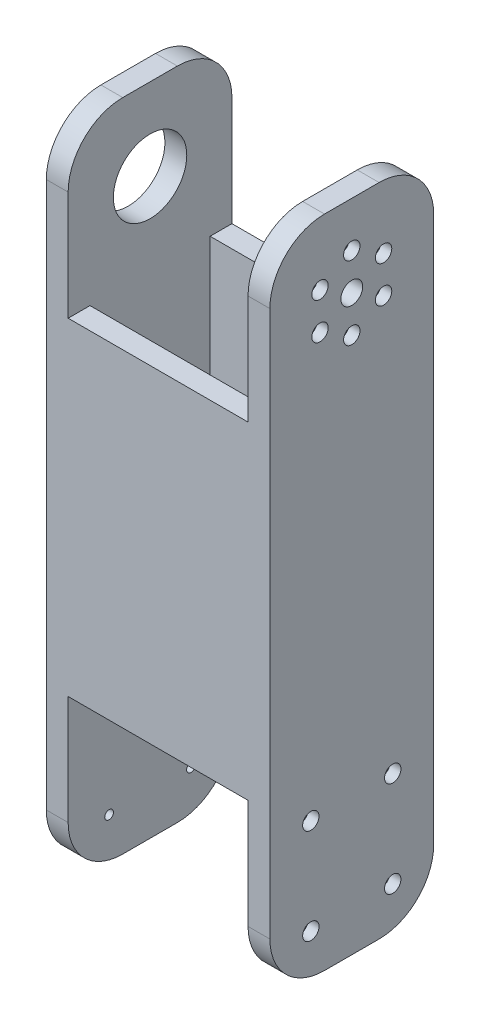
from build123d import *

# Parameters (mm, degrees)
SKETCH_1_W          = 60
SKETCH_1_H          = 240
EXTRUDE_1_DEPTH     = 8
SKETCH_2_R          = 13.45
CUT_EXTRUDE_1_DEPTH = 124.951603459
SKETCH_3_W          = 8
SKETCH_3_H          = 120
EXTRUDE_2_DEPTH     = 65.9
SKETCH_4_W          = 60
SKETCH_4_H          = 240
EXTRUDE_3_DEPTH     = 8
FILLET_1_R          = 20
CUT_EXTRUDE_2_REACH = 150.35
SKETCH_10_R         = 4
SKETCH_10_R_2       = 1.6
SKETCH_11_R         = 1.6
CUT_EXTRUDE_3_DEPTH = 149.349620829
SKETCH_12_R         = 3
CUT_EXTRUDE_4_DEPTH = 4
SKETCH_13_R         = 3
CUT_EXTRUDE_5_DEPTH = 4
CUT_EXTRUDE_START   = -4
SKETCH_14_R         = 3
CUT_EXTRUDE_6_DEPTH = 4


with BuildPart() as part:
    # 草图1 → 凸台-拉伸1 (new body)
    with BuildSketch(Plane(origin=(0, 0, 0), x_dir=(0, 0, -1), z_dir=(1, 0, 0))):
        Rectangle(SKETCH_1_W, SKETCH_1_H)
    extrude(amount=EXTRUDE_1_DEPTH)

    # 草图2 → 切除-拉伸1 (cut, through all)
    with BuildSketch(Plane(origin=(8, 0, 0), x_dir=(0, 0, -1), z_dir=(1, 0, 0))):
        with Locations((0, 90)):
            Circle(SKETCH_2_R)
    extrude(amount=-CUT_EXTRUDE_1_DEPTH, mode=Mode.SUBTRACT)

    # 草图3 → 凸台-拉伸2 (add)
    with BuildSketch(Plane(origin=(8, 0, 0), x_dir=(0, 0, -1), z_dir=(1, 0, 0))):
        with Locations((-26, 0)):
            Rectangle(SKETCH_3_W, SKETCH_3_H)
        with Locations((26, 0)):
            Rectangle(SKETCH_3_W, SKETCH_3_H)
    extrude(amount=EXTRUDE_2_DEPTH)

    # 草图4 → 凸台-拉伸3 (add)
    with BuildSketch(Plane(origin=(73.9, 0, 0), x_dir=(0, 0, -1), z_dir=(1, 0, 0))):
        Rectangle(SKETCH_4_W, SKETCH_4_H)
    extrude(amount=EXTRUDE_3_DEPTH)

    # 圆角1
    fillet_1_edges = [part.edges().sort_by_distance(p)[0] for p in [
        (4, -120, 30),
        (4, -120, -30),
        (4, 120, -30),
        (4, 120, 30),
        (77.9, 120, -30),
        (77.9, 120, 30),
        (77.9, -120, -30),
        (77.9, -120, 30),
    ]]
    fillet(fillet_1_edges, radius=FILLET_1_R)

    # 草图10 → 切除-拉伸2 (cut, up to next)
    with BuildSketch(Plane(origin=(81.9, 0, 0), x_dir=(0, 0, -1), z_dir=(1, 0, 0)), mode=Mode.PRIVATE) as cut_extrude_2_sk1:
        with Locations((0, 90)):
            Circle(SKETCH_10_R)
    cut_extrude_2_tool1 = extrude(cut_extrude_2_sk1.sketch, amount=-CUT_EXTRUDE_2_REACH, mode=Mode.PRIVATE) & part.part
    # 草图10 → 切除-拉伸2 (cut, up to next)
    with BuildSketch(Plane(origin=(81.9, 0, 0), x_dir=(0, 0, -1), z_dir=(1, 0, 0)), mode=Mode.PRIVATE) as cut_extrude_2_sk2:
        with Locations((0, 103.5)):
            Circle(SKETCH_10_R_2)
    cut_extrude_2_tool2 = extrude(cut_extrude_2_sk2.sketch, amount=-CUT_EXTRUDE_2_REACH, mode=Mode.PRIVATE) & part.part
    # 草图10 → 切除-拉伸2 (cut, up to next)
    with BuildSketch(Plane(origin=(81.9, 0, 0), x_dir=(0, 0, -1), z_dir=(1, 0, 0)), mode=Mode.PRIVATE) as cut_extrude_2_sk3:
        with Locations((11.691342951, 96.75)):
            Circle(SKETCH_10_R_2)
    cut_extrude_2_tool3 = extrude(cut_extrude_2_sk3.sketch, amount=-CUT_EXTRUDE_2_REACH, mode=Mode.PRIVATE) & part.part
    # 草图10 → 切除-拉伸2 (cut, up to next)
    with BuildSketch(Plane(origin=(81.9, 0, 0), x_dir=(0, 0, -1), z_dir=(1, 0, 0)), mode=Mode.PRIVATE) as cut_extrude_2_sk4:
        with Locations((11.691342951, 83.25)):
            Circle(SKETCH_10_R_2)
    cut_extrude_2_tool4 = extrude(cut_extrude_2_sk4.sketch, amount=-CUT_EXTRUDE_2_REACH, mode=Mode.PRIVATE) & part.part
    # 草图10 → 切除-拉伸2 (cut, up to next)
    with BuildSketch(Plane(origin=(81.9, 0, 0), x_dir=(0, 0, -1), z_dir=(1, 0, 0)), mode=Mode.PRIVATE) as cut_extrude_2_sk5:
        with Locations((0, 76.5)):
            Circle(SKETCH_10_R_2)
    cut_extrude_2_tool5 = extrude(cut_extrude_2_sk5.sketch, amount=-CUT_EXTRUDE_2_REACH, mode=Mode.PRIVATE) & part.part
    # 草图10 → 切除-拉伸2 (cut, up to next)
    with BuildSketch(Plane(origin=(81.9, 0, 0), x_dir=(0, 0, -1), z_dir=(1, 0, 0)), mode=Mode.PRIVATE) as cut_extrude_2_sk6:
        with Locations((-11.691342951, 83.25)):
            Circle(SKETCH_10_R_2)
    cut_extrude_2_tool6 = extrude(cut_extrude_2_sk6.sketch, amount=-CUT_EXTRUDE_2_REACH, mode=Mode.PRIVATE) & part.part
    # 草图10 → 切除-拉伸2 (cut, up to next)
    with BuildSketch(Plane(origin=(81.9, 0, 0), x_dir=(0, 0, -1), z_dir=(1, 0, 0)), mode=Mode.PRIVATE) as cut_extrude_2_sk7:
        with Locations((-11.691342951, 96.75)):
            Circle(SKETCH_10_R_2)
    cut_extrude_2_tool7 = extrude(cut_extrude_2_sk7.sketch, amount=-CUT_EXTRUDE_2_REACH, mode=Mode.PRIVATE) & part.part
    add(cut_extrude_2_tool1.solids().sort_by_distance((81.9, 90, 0))[0], mode=Mode.SUBTRACT)
    add(cut_extrude_2_tool2.solids().sort_by_distance((81.9, 103.5, 0))[0], mode=Mode.SUBTRACT)
    add(cut_extrude_2_tool3.solids().sort_by_distance((81.9, 96.75, -11.691343))[0], mode=Mode.SUBTRACT)
    add(cut_extrude_2_tool4.solids().sort_by_distance((81.9, 83.25, -11.691343))[0], mode=Mode.SUBTRACT)
    add(cut_extrude_2_tool5.solids().sort_by_distance((81.9, 76.5, 0))[0], mode=Mode.SUBTRACT)
    add(cut_extrude_2_tool6.solids().sort_by_distance((81.9, 83.25, 11.691343))[0], mode=Mode.SUBTRACT)
    add(cut_extrude_2_tool7.solids().sort_by_distance((81.9, 96.75, 11.691343))[0], mode=Mode.SUBTRACT)

    # 草图11 → 切除-拉伸3 (cut, through all)
    with BuildSketch(Plane(origin=(81.9, 0, 0), x_dir=(0, 0, -1), z_dir=(1, 0, 0))):
        with Locations((-15, -70)):
            Circle(SKETCH_11_R)
        with Locations((15, -70)):
            Circle(SKETCH_11_R)
        with Locations((15, -105)):
            Circle(SKETCH_11_R)
        with Locations((-15, -105)):
            Circle(SKETCH_11_R)
    extrude(amount=-CUT_EXTRUDE_3_DEPTH, mode=Mode.SUBTRACT)

    # 草图12 → 切除-拉伸4 (cut)
    with BuildSketch(Plane(origin=(81.9, 0, 0), x_dir=(0, 0, -1), z_dir=(1, 0, 0))):
        with Locations((0, 103.45)):
            Circle(SKETCH_12_R)
        with Locations((11.648041681, 96.725)):
            Circle(SKETCH_12_R)
        with Locations((11.648041681, 83.275)):
            Circle(SKETCH_12_R)
        with Locations((0, 76.55)):
            Circle(SKETCH_12_R)
        with Locations((-11.648041681, 83.275)):
            Circle(SKETCH_12_R)
        with Locations((-11.648041681, 96.725)):
            Circle(SKETCH_12_R)
    extrude(amount=-CUT_EXTRUDE_4_DEPTH, mode=Mode.SUBTRACT)

    # 草图13 → 切除-拉伸5 (cut)
    with BuildSketch(Plane(origin=(81.9, 0, 0), x_dir=(0, 0, -1), z_dir=(1, 0, 0))):
        with Locations((-15, -70)):
            Circle(SKETCH_13_R)
        with Locations((15, -70)):
            Circle(SKETCH_13_R)
        with Locations((15, -105)):
            Circle(SKETCH_13_R)
        with Locations((-15, -105)):
            Circle(SKETCH_13_R)
    extrude(amount=-CUT_EXTRUDE_5_DEPTH, mode=Mode.SUBTRACT)

    # 草图14 → 切除-拉伸6 (cut)
    with BuildSketch(Plane.ZY.offset(CUT_EXTRUDE_START)):
        with Locations((-15, -70)):
            Circle(SKETCH_14_R)
        with Locations((15, -70)):
            Circle(SKETCH_14_R)
        with Locations((15, -105)):
            Circle(SKETCH_14_R)
        with Locations((-15, -105)):
            Circle(SKETCH_14_R)
    extrude(amount=CUT_EXTRUDE_6_DEPTH, mode=Mode.SUBTRACT)


solid = part.part
